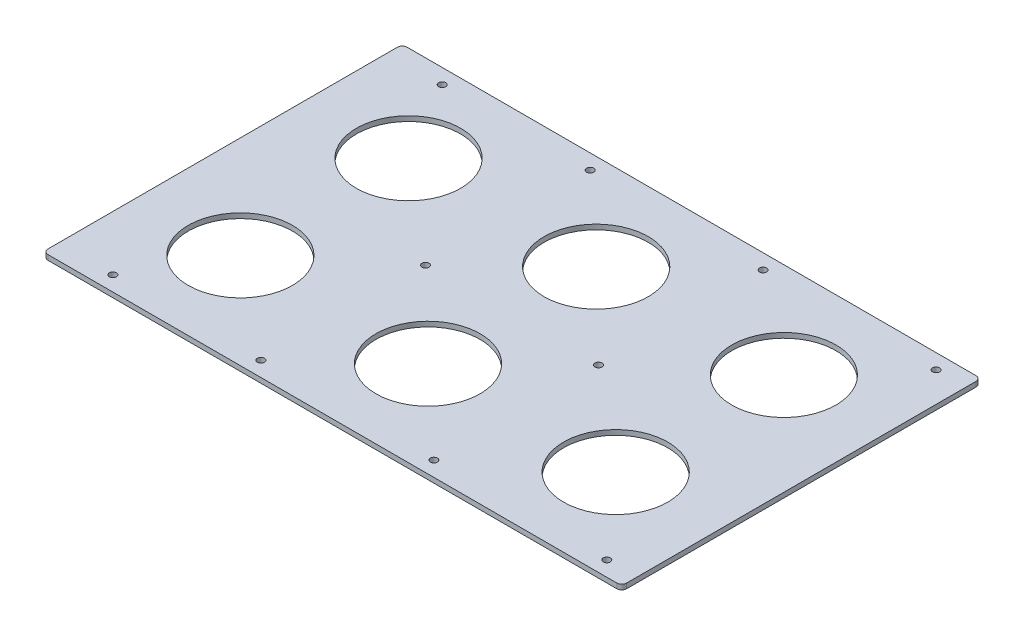
from build123d import *

# Parameters (mm, degrees)
SKETCH1_R           = 33.147
SKETCH1_R_2         = 2.2479
BOSS_EXTRUDE1_DEPTH = 3.175


with BuildPart() as part:
    # Sketch1 → Boss-Extrude1 (new body)
    with BuildSketch(Plane(origin=(0, 0, 0), x_dir=(1, 0, 0), z_dir=(0, 1, 0))):
        with BuildLine():
            Line((-180.975, 114.3), (180.975, 114.3))
            ThreePointArc((180.975, 114.3), (183.22006403, 113.37006403), (184.15, 111.125))
            Line((184.15, 111.125), (184.15, -111.125))
            ThreePointArc((184.15, -111.125), (183.22006403, -113.37006403), (180.975, -114.3))
            Line((180.975, -114.3), (-180.975, -114.3))
            ThreePointArc((-180.975, -114.3), (-183.22006403, -113.37006403), (-184.15, -111.125))
            Line((-184.15, -111.125), (-184.15, 111.125))
            ThreePointArc((-184.15, 111.125), (-183.22006403, 113.37006403), (-180.975, 114.3))
        make_face()
        with Locations((119.508581684, -53.5178)):
            Circle(SKETCH1_R, mode=Mode.SUBTRACT)
        with Locations((-55.033333333, 0)):
            Circle(SKETCH1_R_2, mode=Mode.SUBTRACT)
        with Locations((55.033333333, 0)):
            Circle(SKETCH1_R_2, mode=Mode.SUBTRACT)
        with Locations((119.508581684, 53.5178)):
            Circle(SKETCH1_R, mode=Mode.SUBTRACT)
        with Locations((0.064290842, 53.5178)):
            Circle(SKETCH1_R, mode=Mode.SUBTRACT)
        with Locations((0.064290842, -53.5178)):
            Circle(SKETCH1_R, mode=Mode.SUBTRACT)
        with Locations((-119.38, 53.5178)):
            Circle(SKETCH1_R, mode=Mode.SUBTRACT)
        with Locations((-119.38, -53.5178)):
            Circle(SKETCH1_R, mode=Mode.SUBTRACT)
        with Locations((-149.225, -104.775)):
            Circle(SKETCH1_R_2, mode=Mode.SUBTRACT)
        with Locations((-55.033333333, -104.775)):
            Circle(SKETCH1_R_2, mode=Mode.SUBTRACT)
        with Locations((55.033333333, -104.775)):
            Circle(SKETCH1_R_2, mode=Mode.SUBTRACT)
        with Locations((165.1, -104.775)):
            Circle(SKETCH1_R_2, mode=Mode.SUBTRACT)
        with Locations((-149.225, 104.775)):
            Circle(SKETCH1_R_2, mode=Mode.SUBTRACT)
        with Locations((-55.033333333, 104.775)):
            Circle(SKETCH1_R_2, mode=Mode.SUBTRACT)
        with Locations((55.033333333, 104.775)):
            Circle(SKETCH1_R_2, mode=Mode.SUBTRACT)
        with Locations((165.1, 104.775)):
            Circle(SKETCH1_R_2, mode=Mode.SUBTRACT)
    extrude(amount=BOSS_EXTRUDE1_DEPTH)


solid = part.part
